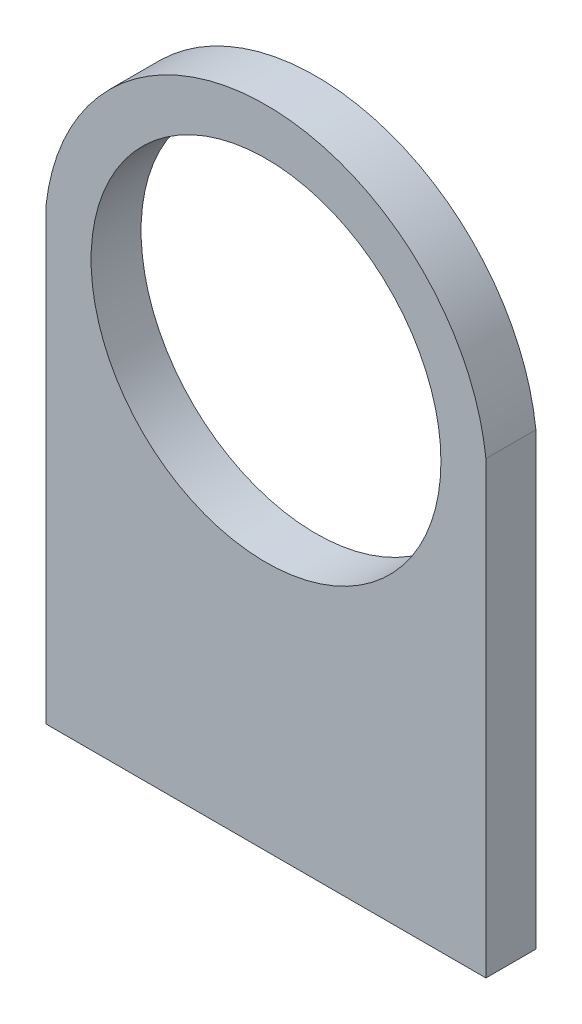
from build123d import *

# Parameters (mm, degrees)
ESQUISSE1_R        = 17.5
BOSS_EXTRU_1_DEPTH = 5


with BuildPart() as part:
    # Esquisse1 → Boss.-Extru.1 (new body)
    with BuildSketch(Plane.XY):
        with BuildLine():
            Line((0, 0), (0, -45))
            Line((0, -45), (44, -45))
            Line((44, -45), (44, 0))
            ThreePointArc((44, 0), (22, 19.641589825), (0, 0))
        make_face()
        with Locations((22, -2.5)):
            Circle(ESQUISSE1_R, mode=Mode.SUBTRACT)
    extrude(amount=BOSS_EXTRU_1_DEPTH)


solid = part.part
